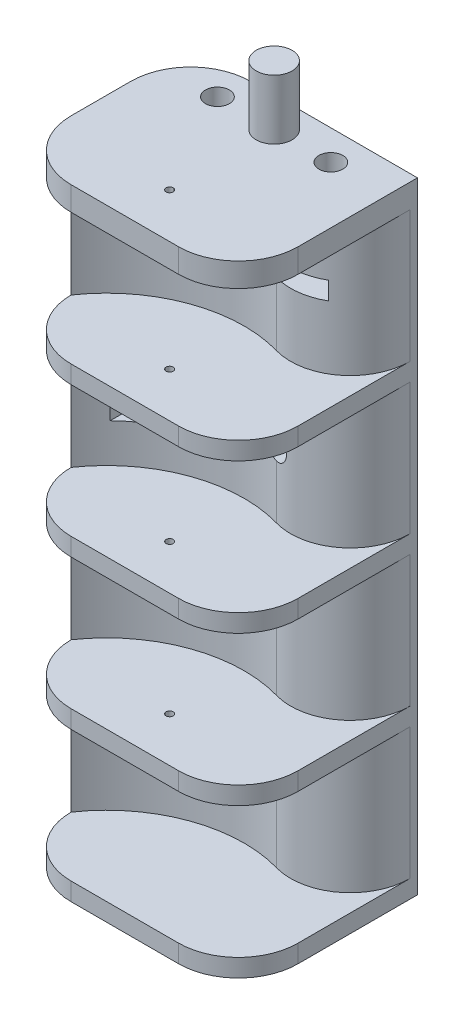
from build123d import *

# Parameters (mm, degrees)
CROQUIS2_R               = 0.6
SALIENTE_EXTRUIR1_DEPTH  = 4
SALIENTE_EXTRUIR2_DEPTH  = 22
CROQUIS4_R               = 2
CORTAR_EXTRUIR1_DEPTH    = 15.4
CROQUIS5_W               = 9
CROQUIS5_H               = 3
CORTAR_EXTRUIR2_DEPTH    = 12
SALIENTE_EXTRUIR4_DEPTH  = 25
SALIENTE_EXTRUIR5_START  = 3
CROQUIS6_R               = 0.6
SALIENTE_EXTRUIR5_DEPTH  = 3
SALIENTE_EXTRUIR10_DEPTH = 25
SALIENTE_EXTRUIR11_START = 3
CROQUIS17_R              = 0.6
SALIENTE_EXTRUIR11_DEPTH = 3
SALIENTE_EXTRUIR12_DEPTH = 25
SALIENTE_EXTRUIR13_START = 3
CROQUIS18_R              = 0.6
SALIENTE_EXTRUIR13_DEPTH = 3
SALIENTE_EXTRUIR14_START = 3
SALIENTE_EXTRUIR14_DEPTH = 3
REDONDEO1_R              = 10
REDONDEO2_R              = 10
CROQUIS22_R              = 3
SALIENTE_EXTRUIR15_DEPTH = 10
CROQUIS25_W              = 6
CROQUIS25_H              = 9
CORTAR_EXTRUIR3_DEPTH    = 35
CROQUIS26_R              = 2.5
CORTAR_EXTRUIR4_DEPTH    = 3
CROQUIS27_W              = 7.374121946
CROQUIS27_H              = 9
CORTAR_EXTRUIR5_DEPTH    = 1
CROQUIS29_R              = 2
CORTAR_EXTRUIR6_DEPTH    = 11.312254328


with BuildPart() as part:
    # Croquis2 → Saliente-Extruir1 (new body)
    with BuildSketch(Plane(origin=(0, 0, 0), x_dir=(1, 0, 0), z_dir=(0, 1, 0))):
        with BuildLine():
            Line((-43.107082341, -17.625158928), (-5.107082341, -17.625158928))
            Line((-5.107082341, -17.625158928), (-5.107082341, -37.625158928))
            ThreePointArc((-5.107082341, -37.625158928), (-8.036014529, -44.69622674), (-15.107082341, -47.625158928))
            Line((-15.107082341, -47.625158928), (-33.107082341, -47.625158928))
            ThreePointArc((-33.107082341, -47.625158928), (-40.178150153, -44.69622674), (-43.107082341, -37.625158928))
            Line((-43.107082341, -37.625158928), (-43.107082341, -17.625158928))
        make_face()
        with Locations(Location((-24.107082341, -40.125158928, 0), (0, 0, 270))):
            Circle(CROQUIS2_R, mode=Mode.SUBTRACT)
    extrude(amount=SALIENTE_EXTRUIR1_DEPTH)

    # Croquis3 → Saliente-Extruir2 (add)
    with BuildSketch(Plane.XZ):
        with BuildLine():
            Line((-43.107082341, 17.625158928), (-5.107082341, 17.625158928))
            Line((-5.107082341, 17.625158928), (-5.107082341, 37.625158928))
            ThreePointArc((-5.107082341, 37.625158928), (-24.107082341, 27.625158928), (-43.107082341, 37.625158928))
            Line((-43.107082341, 37.625158928), (-43.107082341, 17.625158928))
        make_face()
    extrude(amount=SALIENTE_EXTRUIR2_DEPTH)

    # Croquis4 → Cortar-Extruir1 (cut)
    with BuildSketch(Plane(origin=(0, 4, 0), x_dir=(1, 0, 0), z_dir=(0, 1, 0))):
        with Locations(Location((-33.607082341, -22.625158928, 0), (0, 0, 270))):
            Circle(CROQUIS4_R)
        with Locations(Location((-14.607082341, -22.625158928, 0), (0, 0, 270))):
            Circle(CROQUIS4_R)
    extrude(amount=-CORTAR_EXTRUIR1_DEPTH, mode=Mode.SUBTRACT)

    # Croquis5 → Cortar-Extruir2 (cut)
    with BuildSketch(Plane(origin=(0, 0, 17.625158928), x_dir=(-1, 0, 0), z_dir=(0, 0, -1))):
        with Locations((33.607082341, -9.9)):
            Rectangle(CROQUIS5_W, CROQUIS5_H)
        with Locations((14.607082341, -9.9)):
            Rectangle(CROQUIS5_W, CROQUIS5_H)
    extrude(amount=-CORTAR_EXTRUIR2_DEPTH, mode=Mode.SUBTRACT)

    # Croquis9 → Saliente-Extruir4 (add)
    with BuildSketch(Plane.XZ.offset(22)):
        with BuildLine():
            Line((-43.107082341, 37.625158928), (-43.107082341, 17.625158928))
            Line((-43.107082341, 17.625158928), (-5.107082341, 17.625158928))
            Line((-5.107082341, 17.625158928), (-5.107082341, 37.625158928))
            ThreePointArc((-5.107082341, 37.625158928), (-24.107082341, 27.625158928), (-43.107082341, 37.625158928))
        make_face()
    extrude(amount=SALIENTE_EXTRUIR4_DEPTH)

    # Croquis6 → Saliente-Extruir5 (add)
    with BuildSketch(Plane.XZ.offset(22).offset(SALIENTE_EXTRUIR5_START)):
        with BuildLine():
            Line((-43.107082341, 17.625158928), (-5.107082341, 17.625158928))
            Line((-5.107082341, 17.625158928), (-5.107082341, 37.625158928))
            ThreePointArc((-5.107082341, 37.625158928), (-8.036014529, 44.69622674), (-15.107082341, 47.625158928))
            Line((-15.107082341, 47.625158928), (-33.107082341, 47.625158928))
            ThreePointArc((-33.107082341, 47.625158928), (-40.178150153, 44.69622674), (-43.107082341, 37.625158928))
            Line((-43.107082341, 37.625158928), (-43.107082341, 17.625158928))
        make_face()
        with Locations(Location((-24.107082341, 40.125158928, 0), (0, 0, 90))):
            Circle(CROQUIS6_R, mode=Mode.SUBTRACT)
    extrude(amount=-SALIENTE_EXTRUIR5_DEPTH)

    # Croquis16 → Saliente-Extruir10 (add)
    with BuildSketch(Plane.XZ.offset(47)):
        with BuildLine():
            Line((-43.107082341, 37.625158928), (-43.107082341, 17.625158928))
            Line((-43.107082341, 17.625158928), (-5.107082341, 17.625158928))
            Line((-5.107082341, 17.625158928), (-5.107082341, 37.625158928))
            ThreePointArc((-5.107082341, 37.625158928), (-24.107082341, 27.625158928), (-43.107082341, 37.625158928))
        make_face()
    extrude(amount=SALIENTE_EXTRUIR10_DEPTH)

    # Croquis17 → Saliente-Extruir11 (add)
    with BuildSketch(Plane.XZ.offset(47).offset(SALIENTE_EXTRUIR11_START)):
        with BuildLine():
            Line((-43.107082341, 17.625158928), (-5.107082341, 17.625158928))
            Line((-5.107082341, 17.625158928), (-5.107082341, 37.625158928))
            ThreePointArc((-5.107082341, 37.625158928), (-8.036014529, 44.69622674), (-15.107082341, 47.625158928))
            Line((-15.107082341, 47.625158928), (-33.107082341, 47.625158928))
            ThreePointArc((-33.107082341, 47.625158928), (-40.178150153, 44.69622674), (-43.107082341, 37.625158928))
            Line((-43.107082341, 37.625158928), (-43.107082341, 17.625158928))
        make_face()
        with Locations(Location((-24.107082341, 40.125158928, 0), (0, 0, 90))):
            Circle(CROQUIS17_R, mode=Mode.SUBTRACT)
    extrude(amount=-SALIENTE_EXTRUIR11_DEPTH)

    # Croquis20 → Saliente-Extruir12 (add)
    with BuildSketch(Plane.XZ.offset(72)):
        with BuildLine():
            Line((-43.107082341, 37.625158928), (-43.107082341, 17.625158928))
            Line((-43.107082341, 17.625158928), (-5.107082341, 17.625158928))
            Line((-5.107082341, 17.625158928), (-5.107082341, 37.625158928))
            ThreePointArc((-5.107082341, 37.625158928), (-24.107082341, 27.625158928), (-43.107082341, 37.625158928))
        make_face()
    extrude(amount=SALIENTE_EXTRUIR12_DEPTH)

    # Croquis18 → Saliente-Extruir13 (add)
    with BuildSketch(Plane.XZ.offset(72).offset(SALIENTE_EXTRUIR13_START)):
        with BuildLine():
            Line((-43.107082341, 17.625158928), (-5.107082341, 17.625158928))
            Line((-5.107082341, 17.625158928), (-5.107082341, 37.625158928))
            ThreePointArc((-5.107082341, 37.625158928), (-8.036014529, 44.69622674), (-15.107082341, 47.625158928))
            Line((-15.107082341, 47.625158928), (-33.107082341, 47.625158928))
            ThreePointArc((-33.107082341, 47.625158928), (-40.178150153, 44.69622674), (-43.107082341, 37.625158928))
            Line((-43.107082341, 37.625158928), (-43.107082341, 17.625158928))
        make_face()
        with Locations(Location((-24.107082341, 40.125158928, 0), (0, 0, 90))):
            Circle(CROQUIS18_R, mode=Mode.SUBTRACT)
    extrude(amount=-SALIENTE_EXTRUIR13_DEPTH)

    # Croquis21 → Saliente-Extruir14 (add)
    with BuildSketch(Plane.XZ.offset(97).offset(SALIENTE_EXTRUIR14_START)):
        with BuildLine():
            Line((-43.107082341, 17.625158928), (-5.107082341, 17.625158928))
            Line((-5.107082341, 17.625158928), (-5.107082341, 37.625158928))
            ThreePointArc((-5.107082341, 37.625158928), (-8.036014529, 44.69622674), (-15.107082341, 47.625158928))
            Line((-15.107082341, 47.625158928), (-33.107082341, 47.625158928))
            ThreePointArc((-33.107082341, 47.625158928), (-40.178150153, 44.69622674), (-43.107082341, 37.625158928))
            Line((-43.107082341, 37.625158928), (-43.107082341, 17.625158928))
        make_face()
    extrude(amount=-SALIENTE_EXTRUIR14_DEPTH)

    # Redondeo1
    # the kernel refuses this fillet: 10 mm, written as the material it takes off along each edge
    with BuildSketch(Plane(origin=(-5.107082341, -28.122543277, 37.625158928), x_dir=(-0.8124951373534511, 0, -0.5829679680539889), z_dir=(0, -1, 0))) as redondeo1_piece_1_section:
        with BuildLine():
            CenterArc((19.056173651, 9.405402575), REDONDEO1_R, 144.340434386, 105.802050026)
            Line((10.931222277, 15.235082256), (0, 0))
            ThreePointArc((0, 0), (7.829675627, 1.370547065), (15.659351253, 0))
        make_face()
    redondeo1_piece_1 = extrude(amount=115.754913446, mode=Mode.PRIVATE)
    redondeo1_piece_1 = split(redondeo1_piece_1, bisect_by=Plane(origin=(-9.572700752, -47, 31.607563131), z_dir=(0, 1, 0)), keep=Keep.TOP, mode=Mode.PRIVATE)
    add(redondeo1_piece_1, mode=Mode.SUBTRACT)
    with BuildSketch(Plane(origin=(-5.107082341, -28.122543277, 37.625158928), x_dir=(-0.8124951373534511, 0, -0.5829679680539889), z_dir=(0, -1, 0))) as redondeo1_piece_2_section:
        with BuildLine():
            CenterArc((19.056173651, 9.405402575), REDONDEO1_R, 144.340434386, 105.802050026)
            Line((10.931222277, 15.235082256), (0, 0))
            ThreePointArc((0, 0), (7.829675627, 1.370547065), (15.659351253, 0))
        make_face()
    redondeo1_piece_2 = extrude(amount=115.754913446, mode=Mode.PRIVATE)
    redondeo1_piece_2 = split(redondeo1_piece_2, bisect_by=Plane(origin=(-9.572700752, -50, 31.607563131), z_dir=(0, -1, 0)), keep=Keep.TOP, mode=Mode.PRIVATE)
    redondeo1_piece_2 = split(redondeo1_piece_2, bisect_by=Plane(origin=(-9.572700752, -72, 31.607563131), z_dir=(0, 1, 0)), keep=Keep.TOP, mode=Mode.PRIVATE)
    add(redondeo1_piece_2, mode=Mode.SUBTRACT)
    with BuildSketch(Plane(origin=(-5.107082341, -75, 37.625158928), x_dir=(-0.8124951373534507, 0, -0.5829679680539895), z_dir=(0, -1, 0)), Plane(origin=(-5.107082341, -50, 37.625158928), x_dir=(-0.8124951373534507, 0, -0.5829679680539895), z_dir=(0, -1, 0)), Plane(origin=(-5.107082341, 0, 37.625158928), x_dir=(-0.8124951373534509, 0, -0.582967968053989), z_dir=(0, -1, 0))) as redondeo1_piece_3:
        with BuildLine():
            CenterArc((19.056173651, 9.405402575), REDONDEO1_R, 144.340434386, 105.802050026)
            Line((10.931222277, 15.235082256), (0, 0))
            ThreePointArc((0, 0), (7.829675627, 1.370547065), (15.659351253, 0))
        make_face()
    extrude(amount=22, mode=Mode.SUBTRACT)
    with BuildSketch(Plane(origin=(-5.107082341, -3.122543277, 37.625158928), x_dir=(-0.8124951373534511, 0, -0.5829679680539889), z_dir=(0, -1, 0))) as redondeo1_piece_4_section:
        with BuildLine():
            CenterArc((19.056173651, 9.405402575), REDONDEO1_R, 144.340434386, 105.802050026)
            Line((10.931222277, 15.235082256), (0, 0))
            ThreePointArc((0, 0), (7.829675627, 1.370547065), (15.659351253, 0))
        make_face()
    redondeo1_piece_4 = extrude(amount=115.754913446, mode=Mode.PRIVATE)
    redondeo1_piece_4 = split(redondeo1_piece_4, bisect_by=Plane(origin=(-12.770805832, -22, 29.1011401), z_dir=(0, 1, 0)), keep=Keep.TOP, mode=Mode.PRIVATE)
    add(redondeo1_piece_4, mode=Mode.SUBTRACT)
    with BuildSketch(Plane(origin=(-5.107082341, -3.122543277, 37.625158928), x_dir=(-0.8124951373534511, 0, -0.5829679680539889), z_dir=(0, -1, 0))) as redondeo1_piece_5_section:
        with BuildLine():
            CenterArc((19.056173651, 9.405402575), REDONDEO1_R, 144.340434386, 105.802050026)
            Line((10.931222277, 15.235082256), (0, 0))
            ThreePointArc((0, 0), (7.829675627, 1.370547065), (15.659351253, 0))
        make_face()
    redondeo1_piece_5 = extrude(amount=115.754913446, mode=Mode.PRIVATE)
    redondeo1_piece_5 = split(redondeo1_piece_5, bisect_by=Plane(origin=(-12.770805832, -25, 29.1011401), z_dir=(0, -1, 0)), keep=Keep.TOP, mode=Mode.PRIVATE)
    redondeo1_piece_5 = split(redondeo1_piece_5, bisect_by=Plane(origin=(-12.770805832, -47, 29.1011401), z_dir=(0, 1, 0)), keep=Keep.TOP, mode=Mode.PRIVATE)
    add(redondeo1_piece_5, mode=Mode.SUBTRACT)
    with BuildSketch(Plane(origin=(-5.107082341, -3.122543277, 37.625158928), x_dir=(-0.8124951373534511, 0, -0.5829679680539889), z_dir=(0, -1, 0))) as redondeo1_piece_6_section:
        with BuildLine():
            CenterArc((19.056173651, 9.405402575), REDONDEO1_R, 144.340434386, 105.802050026)
            Line((10.931222277, 15.235082256), (0, 0))
            ThreePointArc((0, 0), (7.829675627, 1.370547065), (15.659351253, 0))
        make_face()
    redondeo1_piece_6 = extrude(amount=115.754913446, mode=Mode.PRIVATE)
    redondeo1_piece_6 = split(redondeo1_piece_6, bisect_by=Plane(origin=(-12.770805832, -75, 29.1011401), z_dir=(0, -1, 0)), keep=Keep.TOP, mode=Mode.PRIVATE)
    redondeo1_piece_6 = split(redondeo1_piece_6, bisect_by=Plane(origin=(-12.770805832, -97, 29.1011401), z_dir=(0, 1, 0)), keep=Keep.TOP, mode=Mode.PRIVATE)
    add(redondeo1_piece_6, mode=Mode.SUBTRACT)
    with BuildSketch(Plane(origin=(-5.107082341, 46.877456723, 37.625158928), x_dir=(-0.812495137353451, 0, -0.582967968053989), z_dir=(0, -1, 0))) as redondeo1_piece_7_section:
        with BuildLine():
            CenterArc((19.056173651, 9.405402575), REDONDEO1_R, 144.340434386, 105.802050026)
            Line((10.931222277, 15.235082256), (0, 0))
            ThreePointArc((0, 0), (7.829675627, 1.370547065), (15.659351253, 0))
        make_face()
    redondeo1_piece_7 = extrude(amount=115.754913446, mode=Mode.PRIVATE)
    redondeo1_piece_7 = split(redondeo1_piece_7, bisect_by=Plane(origin=(-12.770805832, -25, 29.1011401), z_dir=(0, -1, 0)), keep=Keep.TOP, mode=Mode.PRIVATE)
    redondeo1_piece_7 = split(redondeo1_piece_7, bisect_by=Plane(origin=(-12.770805832, -47, 29.1011401), z_dir=(0, 1, 0)), keep=Keep.TOP, mode=Mode.PRIVATE)
    add(redondeo1_piece_7, mode=Mode.SUBTRACT)
    with BuildSketch(Plane(origin=(-5.107082341, 46.877456723, 37.625158928), x_dir=(-0.812495137353451, 0, -0.582967968053989), z_dir=(0, -1, 0))) as redondeo1_piece_8_section:
        with BuildLine():
            CenterArc((19.056173651, 9.405402575), REDONDEO1_R, 144.340434386, 105.802050026)
            Line((10.931222277, 15.235082256), (0, 0))
            ThreePointArc((0, 0), (7.829675627, 1.370547065), (15.659351253, 0))
        make_face()
    redondeo1_piece_8 = extrude(amount=115.754913446, mode=Mode.PRIVATE)
    redondeo1_piece_8 = split(redondeo1_piece_8, bisect_by=Plane(origin=(-12.770805832, -50, 29.1011401), z_dir=(0, -1, 0)), keep=Keep.TOP, mode=Mode.PRIVATE)
    add(redondeo1_piece_8, mode=Mode.SUBTRACT)

    # Redondeo2
    # the kernel refuses this fillet: 10 mm, written as the material it takes off along each edge
    with BuildSketch(Plane(origin=(-43.107082341, -125, 17.625158928), x_dir=(1, 0, 0), z_dir=(0, 1, 0))) as redondeo2_piece_1:
        with BuildLine():
            CenterArc((REDONDEO2_R, -REDONDEO2_R), REDONDEO2_R, 90, 90)
            Line((0, -REDONDEO2_R), (0, 0))
            Line((0, 0), (REDONDEO2_R, 0))
        make_face()
    extrude(amount=154, mode=Mode.SUBTRACT)

    # Croquis22 → Saliente-Extruir15 (add)
    with BuildSketch(Plane(origin=(0, 4, 0), x_dir=(1, 0, 0), z_dir=(0, 1, 0))):
        with Locations(Location((-24.107082341, -22.625158928, 0), (0, 0, 90))):
            Circle(CROQUIS22_R)
    extrude(amount=SALIENTE_EXTRUIR15_DEPTH)

    # Croquis25 → Cortar-Extruir3 (cut)
    with BuildSketch(Plane(origin=(-5.107082341, 0, 0), x_dir=(0, 0, -1), z_dir=(1, 0, 0))):
        with Locations((-32.937413255, -36)):
            Rectangle(CROQUIS25_W, CROQUIS25_H)
    extrude(amount=-CORTAR_EXTRUIR3_DEPTH, mode=Mode.SUBTRACT)

    # Croquis26 → Cortar-Extruir4 (cut)
    with BuildSketch(Plane(origin=(-40.107082341, 0, 0), x_dir=(0, 0, -1), z_dir=(1, 0, 0))):
        with Locations((-32.937413255, -36)):
            Circle(CROQUIS26_R)
    extrude(amount=-CORTAR_EXTRUIR4_DEPTH, mode=Mode.SUBTRACT)

    # Croquis27 → Cortar-Extruir5 (cut)
    with BuildSketch(Plane.XY.offset(29.937413255)):
        with Locations((-36.420021368, -36)):
            Rectangle(CROQUIS27_W, CROQUIS27_H)
    extrude(amount=-CORTAR_EXTRUIR5_DEPTH, mode=Mode.SUBTRACT)

    # Croquis29 → Cortar-Extruir6 (cut)
    with BuildSketch(Plane.XY.offset(28.937413255)):
        with Locations((-17.830229088, -36)):
            Circle(CROQUIS29_R)
    extrude(amount=-CORTAR_EXTRUIR6_DEPTH, mode=Mode.SUBTRACT)


solid = part.part
